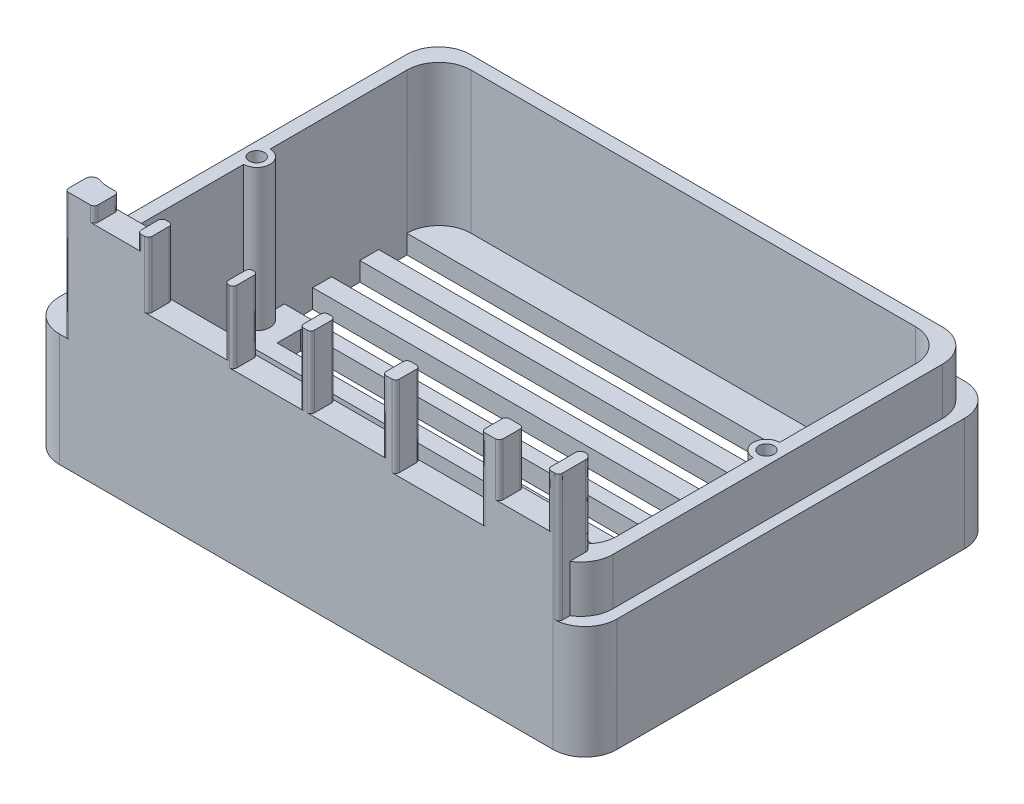
from build123d import *
from OCP.BRepAlgoAPI import BRepAlgoAPI_Cut
from OCP.TopTools import TopTools_ListOfShape

# Parameters (mm, degrees)
SKETCH1_W               = 118.4
SKETCH1_H               = 87.4
BOSS_EXTRUDE1_DEPTH     = 51
SKETCH2_W               = 108
SKETCH2_H               = 77
CUT_EXTRUDE1_DEPTH      = 47
SKETCH3_W               = 82.2
SKETCH3_H               = 17
CUT_EXTRUDE2_DEPTH      = 137.122187758
SKETCH4_W               = 118.4
SKETCH4_H               = 10
CUT_EXTRUDE4_DEPTH      = 2.4
CUT_EXTRUDE5_REACH      = 115.413
SKETCH5_W               = 5.6
SKETCH5_H               = 17
SKETCH5_W_2             = 8
SKETCH5_W_3             = 10.2
SKETCH5_H_2             = 11.2
SKETCH5_W_4             = 18.2
SKETCH5_H_3             = 17.2
SKETCH5_W_5             = 15.2
SKETCH5_H_4             = 15.2
SKETCH5_W_6             = 14.2
SKETCH5_W_7             = 16.2
SKETCH5_H_5             = 14
SKETCH5_W_8             = 9.2
SKETCH5_H_6             = 3.2
SKETCH6_W               = 85
SKETCH6_H               = 10
CUT_EXTRUDE6_DEPTH      = 2.3
SKETCH7_W               = 85
SKETCH7_H               = 10
CUT_EXTRUDE7_DEPTH      = 2.3
SKETCH8_W               = 5.7
SKETCH8_H               = 10
SKETCH8_W_2             = 3.3
CUT_EXTRUDE8_DEPTH      = 2.4
FILLET1_START           = -1
FILLET1_DEPTH           = 52
FILLET1_START_2         = 24
FILLET1_2_DEPTH         = 10
FILLET1_3_DEPTH         = 34
FILLET1_START_3         = 34
FILLET1_4_DEPTH         = 17
FILLET1_5_DEPTH         = 5.8
FILLET2_START           = 37
FILLET2_DEPTH           = 15
FILLET2_START_2         = 39.8
FILLET2_2_DEPTH         = 12.2
FILLET2_START_3         = 24
FILLET2_3_DEPTH         = 13.234576
FILLET2_START_4         = 35.8
FILLET2_4_DEPTH         = 1.434576
FILLET2_START_5         = 47.8
FILLET2_5_DEPTH         = 4.2
FILLET2_START_6         = 33.8
FILLET2_6_DEPTH         = 2.83586
BOSS_EXTRUDE2_DEPTH     = 30
CUT_EXTRUDE9_DEPTH      = 88.311683239
CUT_EXTRUDE9_DEPTH_BACK = 88.311683239
SKETCH10_R              = 1.6
SKETCH11_R              = 3.5
CUT_EXTRUDE10_DEPTH     = 2
SKETCH12_W              = 108
SKETCH12_H              = 6
SKETCH12_W_2            = 95.198067381
SKETCH12_H_2            = 5
CUT_EXTRUDE11_DEPTH     = 10
FILLET3_R               = 1.3


with BuildPart() as part:
    # Sketch1 → Boss-Extrude1 (new body)
    with BuildSketch(Plane(origin=(0, 0, 0), x_dir=(1, 0, 0), z_dir=(0, 1, 0))):
        Rectangle(SKETCH1_W, SKETCH1_H)
    extrude(amount=BOSS_EXTRUDE1_DEPTH)

    # Sketch2 → Cut-Extrude1 (cut)
    with BuildSketch(Plane(origin=(0, 51, 0), x_dir=(1, 0, 0), z_dir=(0, 1, 0))):
        Rectangle(SKETCH2_W, SKETCH2_H)
    extrude(amount=-CUT_EXTRUDE1_DEPTH, mode=Mode.SUBTRACT)

    # Sketch3 → Cut-Extrude2 (cut, through all)
    with BuildSketch(Plane.ZY.offset(59.2)):
        with Locations((-2.6, 42.5)):
            Rectangle(SKETCH3_W, SKETCH3_H)
    extrude(amount=-CUT_EXTRUDE2_DEPTH, mode=Mode.SUBTRACT)

    # Sketch4 → Cut-Extrude4 (cut)
    with BuildSketch(Plane(origin=(0, 0, -43.7), x_dir=(-1, 0, 0), z_dir=(0, 0, -1))):
        with Locations((0, 29)):
            Rectangle(SKETCH4_W, SKETCH4_H)
    extrude(amount=-CUT_EXTRUDE4_DEPTH, mode=Mode.SUBTRACT)

    # Sketch5 → Cut-Extrude5 (cut, up to next)
    with BuildSketch(Plane(origin=(0, 0, 38.5), x_dir=(-1, 0, 0), z_dir=(0, 0, -1)), mode=Mode.PRIVATE) as cut_extrude5_sk1:
        with Locations((-56.4, 42.5)):
            Rectangle(SKETCH5_W, SKETCH5_H)
    cut_extrude5_tool1 = extrude(cut_extrude5_sk1.sketch, amount=-CUT_EXTRUDE5_REACH, mode=Mode.PRIVATE) & part.part
    # Sketch5 → Cut-Extrude5 (cut, up to next)
    with BuildSketch(Plane(origin=(0, 0, 38.5), x_dir=(-1, 0, 0), z_dir=(0, 0, -1)), mode=Mode.PRIVATE) as cut_extrude5_sk2:
        with Locations((55.2, 42.5)):
            Rectangle(SKETCH5_W_2, SKETCH5_H)
    cut_extrude5_tool2 = extrude(cut_extrude5_sk2.sketch, amount=-CUT_EXTRUDE5_REACH, mode=Mode.PRIVATE) & part.part
    # Sketch5 → Cut-Extrude5 (cut, up to next)
    with BuildSketch(Plane(origin=(0, 0, 38.5), x_dir=(-1, 0, 0), z_dir=(0, 0, -1)), mode=Mode.PRIVATE) as cut_extrude5_sk3:
        with Locations((-46.1, 45.4)):
            Rectangle(SKETCH5_W_3, SKETCH5_H_2)
    cut_extrude5_tool3 = extrude(cut_extrude5_sk3.sketch, amount=-CUT_EXTRUDE5_REACH, mode=Mode.PRIVATE) & part.part
    # Sketch5 → Cut-Extrude5 (cut, up to next)
    with BuildSketch(Plane(origin=(0, 0, 38.5), x_dir=(-1, 0, 0), z_dir=(0, 0, -1)), mode=Mode.PRIVATE) as cut_extrude5_sk4:
        with Locations((-28.1, 42.4)):
            Rectangle(SKETCH5_W_4, SKETCH5_H_3)
    cut_extrude5_tool4 = extrude(cut_extrude5_sk4.sketch, amount=-CUT_EXTRUDE5_REACH, mode=Mode.PRIVATE) & part.part
    # Sketch5 → Cut-Extrude5 (cut, up to next)
    with BuildSketch(Plane(origin=(0, 0, 38.5), x_dir=(-1, 0, 0), z_dir=(0, 0, -1)), mode=Mode.PRIVATE) as cut_extrude5_sk5:
        with Locations((-8.6, 43.4)):
            Rectangle(SKETCH5_W_5, SKETCH5_H_4)
    cut_extrude5_tool5 = extrude(cut_extrude5_sk5.sketch, amount=-CUT_EXTRUDE5_REACH, mode=Mode.PRIVATE) & part.part
    # Sketch5 → Cut-Extrude5 (cut, up to next)
    with BuildSketch(Plane(origin=(0, 0, 38.5), x_dir=(-1, 0, 0), z_dir=(0, 0, -1)), mode=Mode.PRIVATE) as cut_extrude5_sk6:
        with Locations((8.4, 43.4)):
            Rectangle(SKETCH5_W_6, SKETCH5_H_4)
    cut_extrude5_tool6 = extrude(cut_extrude5_sk6.sketch, amount=-CUT_EXTRUDE5_REACH, mode=Mode.PRIVATE) & part.part
    # Sketch5 → Cut-Extrude5 (cut, up to next)
    with BuildSketch(Plane(origin=(0, 0, 38.5), x_dir=(-1, 0, 0), z_dir=(0, 0, -1)), mode=Mode.PRIVATE) as cut_extrude5_sk7:
        with Locations((25.4, 44)):
            Rectangle(SKETCH5_W_7, SKETCH5_H_5)
    cut_extrude5_tool7 = extrude(cut_extrude5_sk7.sketch, amount=-CUT_EXTRUDE5_REACH, mode=Mode.PRIVATE) & part.part
    # Sketch5 → Cut-Extrude5 (cut, up to next)
    with BuildSketch(Plane(origin=(0, 0, 38.5), x_dir=(-1, 0, 0), z_dir=(0, 0, -1)), mode=Mode.PRIVATE) as cut_extrude5_sk8:
        with Locations((40.4, 49.4)):
            Rectangle(SKETCH5_W_8, SKETCH5_H_6)
    cut_extrude5_tool8 = extrude(cut_extrude5_sk8.sketch, amount=-CUT_EXTRUDE5_REACH, mode=Mode.PRIVATE) & part.part
    add(cut_extrude5_tool1.solids().sort_by_distance((56.4, 42.5, 38.5))[0], mode=Mode.SUBTRACT)
    add(cut_extrude5_tool2.solids().sort_by_distance((-55.2, 42.5, 38.5))[0], mode=Mode.SUBTRACT)
    add(cut_extrude5_tool3.solids().sort_by_distance((46.1, 45.4, 38.5))[0], mode=Mode.SUBTRACT)
    add(cut_extrude5_tool4.solids().sort_by_distance((28.1, 42.4, 38.5))[0], mode=Mode.SUBTRACT)
    add(cut_extrude5_tool5.solids().sort_by_distance((8.6, 43.4, 38.5))[0], mode=Mode.SUBTRACT)
    add(cut_extrude5_tool6.solids().sort_by_distance((-8.4, 43.4, 38.5))[0], mode=Mode.SUBTRACT)
    add(cut_extrude5_tool7.solids().sort_by_distance((-25.4, 44, 38.5))[0], mode=Mode.SUBTRACT)
    add(cut_extrude5_tool8.solids().sort_by_distance((-40.4, 49.4, 38.5))[0], mode=Mode.SUBTRACT)

    # Sketch6 → Cut-Extrude6 (cut)
    with BuildSketch(Plane(origin=(59.2, 0, 0), x_dir=(0, 0, -1), z_dir=(1, 0, 0))):
        with Locations((-1.2, 29)):
            Rectangle(SKETCH6_W, SKETCH6_H)
    extrude(amount=-CUT_EXTRUDE6_DEPTH, mode=Mode.SUBTRACT)

    # Sketch7 → Cut-Extrude7 (cut)
    with BuildSketch(Plane.ZY.offset(59.2)):
        with Locations((1.2, 29)):
            Rectangle(SKETCH7_W, SKETCH7_H)
    extrude(amount=-CUT_EXTRUDE7_DEPTH, mode=Mode.SUBTRACT)

    # Sketch8 → Cut-Extrude8 (cut)
    with BuildSketch(Plane.XY.offset(43.7)):
        with Locations((-54.05, 29)):
            Rectangle(SKETCH8_W, SKETCH8_H)
        with Locations((55.25, 29)):
            Rectangle(SKETCH8_W_2, SKETCH8_H)
    extrude(amount=-CUT_EXTRUDE8_DEPTH, mode=Mode.SUBTRACT)

    # Fillet1: read off the stored shape, not the designer's step
    # Fillet1 outline → Fillet1 (cut)
    with BuildSketch(Plane(origin=(0, 0, 0), x_dir=(1, 0, 0), z_dir=(0, 1, 0)).offset(FILLET1_START)):
        with BuildLine():
            Line((52.4, -43.7), (59.2, -43.7))
            Line((59.2, -43.7), (59.2, -36.9))
            add(Edge.make_bspline(
                [(59.2, -36.9), (59.2, -38.590026549), (58.664314748, -40.570505841), (57.311811615, -42.306908661), (55.374285461, -43.275178701), (53.355064375, -43.637193322), (53.111635527, -43.669272126), (52.870751402, -43.689994374), (52.633303895, -43.7), (52.4, -43.7)],
                knots=[0, 0, 0, 0, 0, 0, 0.878697966, 0.878697966, 0.878697966, 0.878697966, 1, 1, 1, 1, 1, 1], degree=5, weights=[1, 1, 0.980118224, 0.977315352, 1, 1, 1.000001049, 1.000001832, 1, 1]))
        make_face()
        with BuildLine():
            Line((-59.2, -43.7), (-52.4, -43.7))
            add(Edge.make_bspline(
                [(-52.4, -43.7), (-59.2, -43.7), (-59.2, -36.9)],
                knots=[0, 0, 0, 1, 1, 1], degree=2, weights=[1, 0.707106781, 1]))
            Line((-59.2, -36.9), (-59.2, -43.7))
        make_face()
        with BuildLine():
            Line((-59.2, 43.7), (-59.2, 36.9))
            add(Edge.make_bspline(
                [(-59.2, 36.9), (-59.2, 43.7), (-52.4, 43.7)],
                knots=[0, 0, 0, 1, 1, 1], degree=2, weights=[1, 0.707106781, 1]))
            Line((-52.4, 43.7), (-59.2, 43.7))
        make_face()
        with BuildLine():
            add(Edge.make_bspline(
                [(52.4, 43.7), (59.2, 43.7), (59.2, 36.9)],
                knots=[0, 0, 0, 1, 1, 1], degree=2, weights=[1, 0.707106781, 1]))
            Line((59.2, 36.9), (59.2, 43.7))
            Line((59.2, 43.7), (52.4, 43.7))
        make_face()
    extrude(amount=FILLET1_DEPTH, mode=Mode.SUBTRACT)

    # Fillet1 2 outline → Fillet1 2 (cut)
    with BuildSketch(Plane(origin=(0, 0, 0), x_dir=(1, 0, 0), z_dir=(0, 1, 0)).offset(FILLET1_START_2)):
        with BuildLine():
            Line((-56.9, -41.3), (-51.2, -41.3))
            add(Edge.make_bspline(
                [(-51.2, -41.3), (-56.9, -40.365634989), (-56.9, -34.589560372)],
                knots=[0, 0, 0, 1, 1, 1], degree=2, weights=[1, 0.762156384, 1]))
            Line((-56.9, -34.589560372), (-56.9, -41.3))
        make_face()
        with BuildLine():
            add(Edge.make_bspline(
                [(53.6, -41.3), (56.9, -39.318899982), (56.9, -35.469905661)],
                knots=[0, 0, 0, 1, 1, 1], degree=2, weights=[1, 0.870260272, 1]))
            Line((53.6, -41.3), (56.9, -41.3))
            Line((56.9, -41.3), (56.9, -35.469905661))
        make_face()
        with BuildLine():
            Line((-56.9, 41.3), (-56.9, 34.5))
            add(Edge.make_bspline(
                [(-56.9, 34.5), (-56.9, 41.3), (-50.1, 41.3)],
                knots=[0, 0, 0, 1, 1, 1], degree=2, weights=[1, 0.707106781, 1]))
            Line((-50.1, 41.3), (-56.9, 41.3))
        make_face()
        with BuildLine():
            add(Edge.make_bspline(
                [(56.9, 34.5), (56.9, 41.3), (50.1, 41.3)],
                knots=[0, 0, 0, 1, 1, 1], degree=2, weights=[1, 0.707106781, 1]))
            Line((56.9, 34.5), (56.9, 41.3))
            Line((56.9, 41.3), (50.1, 41.3))
        make_face()
    extrude(amount=FILLET1_2_DEPTH, mode=Mode.SUBTRACT)

    # Fillet1 3 outline → Fillet1 3 (add)
    with BuildSketch(Plane(origin=(0, 0, 0), x_dir=(1, 0, 0), z_dir=(0, 1, 0))):
        with BuildLine():
            add(Edge.make_bspline(
                [(-47.2, -38.5), (-47.979596074, -38.5), (-48.805907772, -38.388247039), (-49.651414457, -38.1381004), (-50.465894952, -37.733073683), (-52.27699513, -36.415692151), (-53.191387112, -35.345675661), (-53.758854429, -34.09383083), (-54, -32.843734371), (-54, -31.7)],
                knots=[0, 0, 0, 0, 0, 0, 0.405336523, 0.405336523, 0.405336523, 0.405336523, 1, 1, 1, 1, 1, 1], degree=5, weights=[1, 1, 0.999726836, 0.999433949, 1, 1, 0.995728847, 0.997176775, 1, 1]))
            Line((-54, -31.7), (-54, -38.5))
            Line((-54, -38.5), (-47.2, -38.5))
        make_face()
        with BuildLine():
            Line((47.2, -38.5), (54, -38.5))
            Line((54, -38.5), (54, -31.7))
            add(Edge.make_bspline(
                [(54, -31.7), (54, -32.141646182), (53.964145171, -32.598139039), (53.887610478, -33.064701212), (53.766491651, -33.534105438), (53.335326997, -34.735003554), (52.955521738, -35.458885404), (52.458741016, -36.131453078), (51.861119906, -36.718196864), (50.465894952, -37.733073683), (49.651414457, -38.1381004), (48.805907772, -38.388247039), (47.979596074, -38.5), (47.2, -38.5)],
                knots=[0, 0, 0, 0, 0, 0, 0.229625743, 0.229625743, 0.229625743, 0.229625743, 0.594663477, 0.594663477, 0.594663477, 0.594663477, 1, 1, 1, 1, 1, 1], degree=5, weights=[1, 1, 1.000005527, 0.999986472, 1, 1, 0.999289956, 0.99922285, 1, 1, 0.999433949, 0.999726836, 1, 1]))
        make_face()
        with BuildLine():
            Line((-54, 38.5), (-54, 31.7))
            add(Edge.make_bspline(
                [(-54, 31.7), (-54, 38.5), (-47.2, 38.5)],
                knots=[0, 0, 0, 1, 1, 1], degree=2, weights=[1, 0.707106781, 1]))
            Line((-47.2, 38.5), (-54, 38.5))
        make_face()
        with BuildLine():
            Line((54, 38.5), (47.2, 38.5))
            add(Edge.make_bspline(
                [(47.2, 38.5), (54, 38.5), (54, 31.7)],
                knots=[0, 0, 0, 1, 1, 1], degree=2, weights=[1, 0.707106781, 1]))
            Line((54, 31.7), (54, 38.5))
        make_face()
    extrude(amount=FILLET1_3_DEPTH)

    # Fillet1 4 outline → Fillet1 4 (add)
    with BuildSketch(Plane(origin=(0, 0, 0), x_dir=(1, 0, 0), z_dir=(0, 1, 0)).offset(FILLET1_START_3)):
        with BuildLine():
            Line((-51.2, -38.5), (-47.2, -38.5))
            add(Edge.make_bspline(
                [(-47.2, -38.5), (-49.411545582, -38.5), (-51.2, -37.199090834)],
                knots=[0, 0, 0, 0.405336523, 0.405336523, 0.405336523], degree=2, weights=[1, 0.881279681, 0.858802725]))
            Line((-51.2, -37.199090834), (-51.2, -38.5))
        make_face()
        with BuildLine():
            add(Edge.make_bspline(
                [(53.6, -33.997825059), (52.892697239, -35.967834767), (51.2, -37.199090834)],
                knots=[0.229625743, 0.229625743, 0.229625743, 0.594663477, 0.594663477, 0.594663477], degree=2, weights=[0.896375691, 0.83856044, 0.858802725]))
            Line((51.2, -37.199090834), (51.2, -38.5))
            Line((51.2, -38.5), (53.6, -38.5))
            Line((53.6, -38.5), (53.6, -33.997825059))
        make_face()
    extrude(amount=FILLET1_4_DEPTH)

    # Fillet1 5 outline → Fillet1 5 (add)
    with BuildSketch(Plane(origin=(0, 0, 0), x_dir=(1, 0, 0), z_dir=(0, 1, 0)).offset(FILLET1_START_3)):
        with BuildLine():
            add(Edge.make_bspline(
                [(51.2, -37.199090834), (49.411545582, -38.5), (47.2, -38.5)],
                knots=[0.594663477, 0.594663477, 0.594663477, 1, 1, 1], degree=2, weights=[0.858802725, 0.881279681, 1]))
            Line((47.2, -38.5), (51.2, -38.5))
            Line((51.2, -38.5), (51.2, -37.199090834))
        make_face()
    extrude(amount=FILLET1_5_DEPTH)


with BuildPart() as fillet2_tool:
    # Fillet2: read off the stored shape, not the designer's step
    # Fillet2 outline → Fillet2 (new body)
    with BuildSketch(Plane(origin=(0, 0, 0), x_dir=(1.0, -2.468840305253112e-12, 0), z_dir=(2.468840305253112e-12, 1.0, 1.6764333355453864e-12)).offset(FILLET2_START)):
        with BuildLine():
            Line((53.6, -43.593280212), (53.6, -42.886651819))
            add(Edge.make_bspline(
                [(53.6, -42.886651819), (53.6, -43.634983296), (52.853333333, -43.684872061)],
                knots=[0, 0, 0, 1, 1, 1], degree=2, weights=[1, 0.730296743, 1]))
            add(Edge.make_bspline(
                [(53.6, -43.593280212), (53.229203683, -43.659758167), (52.853333333, -43.684872061)],
                knots=[0.878697966, 0.878697966, 0.878697966, 0.953450483, 0.953450483, 0.953450483], degree=2, weights=[0.937562283, 0.954145092, 0.97400124]))
        make_face()
        with BuildLine():
            Line((37.2, -43.7), (38, -43.7))
            add(Edge.make_bspline(
                [(37.2, -42.9), (37.2, -43.7), (38, -43.7)],
                knots=[0, 0, 0, 1, 1, 1], degree=2, weights=[1, 0.707106781, 1]))
            Line((37.2, -42.9), (37.2, -43.7))
        make_face()
        with BuildLine():
            add(Edge.make_bspline(
                [(37.2, -39.3), (37.2, -38.5), (38, -38.5)],
                knots=[0, 0, 0, 1, 1, 1], degree=2, weights=[1, 0.707106781, 1]))
            Line((38, -38.5), (37.2, -38.5))
            Line((37.2, -38.5), (37.2, -39.3))
        make_face()
        with BuildLine():
            Line((18.2, -43.7), (19, -43.7))
            Line((19, -43.7), (19, -42.9))
            add(Edge.make_bspline(
                [(19, -42.9), (19, -43.7), (18.2, -43.7)],
                knots=[0, 0, 0, 1, 1, 1], degree=2, weights=[1, 0.707106781, 1]))
        make_face()
        with BuildLine():
            Line((19, -39.3), (19, -38.5))
            Line((19, -38.5), (18.2, -38.5))
            add(Edge.make_bspline(
                [(19, -39.3), (19, -38.5), (18.2, -38.5)],
                knots=[0, 0, 0, 1, 1, 1], degree=2, weights=[1, 0.707106781, 1]))
        make_face()
        with BuildLine():
            Line((16.2, -43.7), (17, -43.7))
            add(Edge.make_bspline(
                [(16.2, -42.9), (16.2, -43.7), (17, -43.7)],
                knots=[0, 0, 0, 1, 1, 1], degree=2, weights=[1, 0.707106781, 1]))
            Line((16.2, -42.9), (16.2, -43.7))
        make_face()
        with BuildLine():
            add(Edge.make_bspline(
                [(16.2, -39.3), (16.2, -38.5), (17, -38.5)],
                knots=[0, 0, 0, 1, 1, 1], degree=2, weights=[1, 0.707106781, 1]))
            Line((17, -38.5), (16.2, -38.5))
            Line((16.2, -38.5), (16.2, -39.3))
        make_face()
        with BuildLine():
            Line((0.2, -43.7), (1, -43.7))
            Line((1, -43.7), (1, -42.9))
            add(Edge.make_bspline(
                [(1, -42.9), (1, -43.7), (0.2, -43.7)],
                knots=[0, 0, 0, 1, 1, 1], degree=2, weights=[1, 0.707106781, 1]))
        make_face()
        with BuildLine():
            Line((1, -39.3), (1, -38.5))
            Line((1, -38.5), (0.2, -38.5))
            add(Edge.make_bspline(
                [(1, -39.3), (1, -38.5), (0.2, -38.5)],
                knots=[0, 0, 0, 1, 1, 1], degree=2, weights=[1, 0.707106781, 1]))
        make_face()
        with BuildLine():
            Line((-1.3, -43.7), (-0.5, -43.7))
            add(Edge.make_bspline(
                [(-1.3, -42.9), (-1.3, -43.7), (-0.5, -43.7)],
                knots=[0, 0, 0, 1, 1, 1], degree=2, weights=[1, 0.707106781, 1]))
            Line((-1.3, -42.9), (-1.3, -43.7))
        make_face()
        with BuildLine():
            add(Edge.make_bspline(
                [(-1.3, -39.3), (-1.3, -38.5), (-0.5, -38.5)],
                knots=[0, 0, 0, 1, 1, 1], degree=2, weights=[1, 0.707106781, 1]))
            Line((-0.5, -38.5), (-1.3, -38.5))
            Line((-1.3, -38.5), (-1.3, -39.3))
        make_face()
        with BuildLine():
            Line((-16.3, -43.7), (-15.5, -43.7))
            Line((-15.5, -43.7), (-15.5, -42.9))
            add(Edge.make_bspline(
                [(-15.5, -42.9), (-15.5, -43.7), (-16.3, -43.7)],
                knots=[0, 0, 0, 1, 1, 1], degree=2, weights=[1, 0.707106781, 1]))
        make_face()
        with BuildLine():
            Line((-15.5, -39.3), (-15.5, -38.5))
            Line((-15.5, -38.5), (-16.3, -38.5))
            add(Edge.make_bspline(
                [(-15.5, -39.3), (-15.5, -38.5), (-16.3, -38.5)],
                knots=[0, 0, 0, 1, 1, 1], degree=2, weights=[1, 0.707106781, 1]))
        make_face()
        with BuildLine():
            Line((-17.3, -43.7), (-16.5, -43.7))
            add(Edge.make_bspline(
                [(-17.3, -42.9), (-17.3, -43.7), (-16.5, -43.7)],
                knots=[0, 0, 0, 1, 1, 1], degree=2, weights=[1, 0.707106781, 1]))
            Line((-17.3, -42.9), (-17.3, -43.7))
        make_face()
        with BuildLine():
            add(Edge.make_bspline(
                [(-17.3, -39.3), (-17.3, -38.5), (-16.5, -38.5)],
                knots=[0, 0, 0, 1, 1, 1], degree=2, weights=[1, 0.707106781, 1]))
            Line((-16.5, -38.5), (-17.3, -38.5))
            Line((-17.3, -38.5), (-17.3, -39.3))
        make_face()
        with BuildLine():
            Line((-34.3, -43.7), (-33.5, -43.7))
            Line((-33.5, -43.7), (-33.5, -42.9))
            add(Edge.make_bspline(
                [(-33.5, -42.9), (-33.5, -43.7), (-34.3, -43.7)],
                knots=[0, 0, 0, 1, 1, 1], degree=2, weights=[1, 0.707106781, 1]))
        make_face()
        with BuildLine():
            Line((-33.5, -39.3), (-33.5, -38.5))
            Line((-33.5, -38.5), (-34.3, -38.5))
            add(Edge.make_bspline(
                [(-33.5, -39.3), (-33.5, -38.5), (-34.3, -38.5)],
                knots=[0, 0, 0, 1, 1, 1], degree=2, weights=[1, 0.707106781, 1]))
        make_face()
        with BuildLine():
            Line((-51.2, -43.7), (-50.4, -43.7))
            add(Edge.make_bspline(
                [(-51.2, -42.9), (-51.2, -43.7), (-50.4, -43.7)],
                knots=[0, 0, 0, 1, 1, 1], degree=2, weights=[1, 0.707106781, 1]))
            Line((-51.2, -42.9), (-51.2, -43.7))
        make_face()
    extrude(amount=FILLET2_DEPTH)


with BuildPart() as part_1:
    add(part.part)

    # Fillet2: cut by fillet2_tool, with a tolerance
    fillet2_stock = TopTools_ListOfShape()
    fillet2_stock.Append(part_1.part.wrapped)
    fillet2_tools = TopTools_ListOfShape()
    fillet2_tools.Append(fillet2_tool.part.wrapped)
    fillet2_cut = BRepAlgoAPI_Cut()
    fillet2_cut.SetArguments(fillet2_stock)
    fillet2_cut.SetTools(fillet2_tools)
    fillet2_cut.SetFuzzyValue(0.00001)
    fillet2_cut.Build()
    add(Compound.cast(fillet2_cut.Shape()).solids(), mode=Mode.REPLACE)


with BuildPart() as fillet2_2_tool:
    # Fillet2 2 outline → Fillet2 2 (new body)
    with BuildSketch(Plane(origin=(0, 0, 0), x_dir=(1.0, -2.468840305253112e-12, 0), z_dir=(2.468840305253112e-12, 1.0, 1.6764333355453864e-12)).offset(FILLET2_START_2)):
        with BuildLine():
            Line((51.2, -43.7), (52, -43.7))
            add(Edge.make_bspline(
                [(51.2, -42.9), (51.2, -43.7), (52, -43.7)],
                knots=[0, 0, 0, 1, 1, 1], degree=2, weights=[1, 0.707106781, 1]))
            Line((51.2, -42.9), (51.2, -43.7))
        make_face()
        with BuildLine():
            add(Edge.make_bspline(
                [(51.494736842, -36.972118688), (51.2, -37.212215174), (51.2, -37.592367945)],
                knots=[0, 0, 0, 1, 1, 1], degree=2, weights=[1, 0.903210647, 1]))
            add(Edge.make_bspline(
                [(51.494736842, -36.972118688), (51.350473785, -37.089637261), (51.2, -37.199090834)],
                knots=[0.561500966, 0.561500966, 0.561500966, 0.594663477, 0.594663477, 0.594663477], degree=2, weights=[0.855769051, 0.856963778, 0.858802725]))
            Line((51.2, -37.199090834), (51.2, -37.592367945))
        make_face()
        with BuildLine():
            Line((40.2, -43.7), (41, -43.7))
            Line((41, -43.7), (41, -42.9))
            add(Edge.make_bspline(
                [(41, -42.9), (41, -43.7), (40.2, -43.7)],
                knots=[0, 0, 0, 1, 1, 1], degree=2, weights=[1, 0.707106781, 1]))
        make_face()
        with BuildLine():
            Line((41, -39.3), (41, -38.5))
            Line((41, -38.5), (40.2, -38.5))
            add(Edge.make_bspline(
                [(41, -39.3), (41, -38.5), (40.2, -38.5)],
                knots=[0, 0, 0, 1, 1, 1], degree=2, weights=[1, 0.707106781, 1]))
        make_face()
    extrude(amount=FILLET2_2_DEPTH)


with BuildPart() as part_2:
    add(part_1.part)

    # Fillet2 2: cut by fillet2_2_tool, with a tolerance
    fillet2_2_stock = TopTools_ListOfShape()
    fillet2_2_stock.Append(part_2.part.wrapped)
    fillet2_2_tools = TopTools_ListOfShape()
    fillet2_2_tools.Append(fillet2_2_tool.part.wrapped)
    fillet2_2_cut = BRepAlgoAPI_Cut()
    fillet2_2_cut.SetArguments(fillet2_2_stock)
    fillet2_2_cut.SetTools(fillet2_2_tools)
    fillet2_2_cut.SetFuzzyValue(0.00001)
    fillet2_2_cut.Build()
    add(Compound.cast(fillet2_2_cut.Shape()).solids(), mode=Mode.REPLACE)


with BuildPart() as fillet2_3_tool:
    # Fillet2 3 outline → Fillet2 3 (new body)
    with BuildSketch(Plane(origin=(0, 0, 0), x_dir=(1.0, -2.468840305253112e-12, 0), z_dir=(2.468840305253112e-12, 1.0, 1.6764333355453864e-12)).offset(FILLET2_START_3)):
        with BuildLine():
            Line((53.6, -43.593280212), (53.6, -42.886651819))
            add(Edge.make_bspline(
                [(53.6, -42.886651819), (53.6, -43.634983296), (52.853333333, -43.684872061)],
                knots=[0, 0, 0, 1, 1, 1], degree=2, weights=[1, 0.730296743, 1]))
            add(Edge.make_bspline(
                [(53.6, -43.593280212), (53.229203683, -43.659758167), (52.853333333, -43.684872061)],
                knots=[0.878697966, 0.878697966, 0.878697966, 0.953450483, 0.953450483, 0.953450483], degree=2, weights=[0.937562283, 0.954145092, 0.97400124]))
        make_face()
        with BuildLine():
            Line((-51.2, -43.7), (-50.4, -43.7))
            add(Edge.make_bspline(
                [(-51.2, -42.9), (-51.2, -43.7), (-50.4, -43.7)],
                knots=[0, 0, 0, 1, 1, 1], degree=2, weights=[1, 0.707106781, 1]))
            Line((-51.2, -42.9), (-51.2, -43.7))
        make_face()
    extrude(amount=FILLET2_3_DEPTH)


with BuildPart() as part_3:
    add(part_2.part)

    # Fillet2 3: cut by fillet2_3_tool, with a tolerance
    fillet2_3_stock = TopTools_ListOfShape()
    fillet2_3_stock.Append(part_3.part.wrapped)
    fillet2_3_tools = TopTools_ListOfShape()
    fillet2_3_tools.Append(fillet2_3_tool.part.wrapped)
    fillet2_3_cut = BRepAlgoAPI_Cut()
    fillet2_3_cut.SetArguments(fillet2_3_stock)
    fillet2_3_cut.SetTools(fillet2_3_tools)
    fillet2_3_cut.SetFuzzyValue(0.00001)
    fillet2_3_cut.Build()
    add(Compound.cast(fillet2_3_cut.Shape()).solids(), mode=Mode.REPLACE)


with BuildPart() as fillet2_4_tool:
    # Fillet2 4 outline → Fillet2 4 (new body)
    with BuildSketch(Plane(origin=(0, 0, 0), x_dir=(1.0, -2.468840305253112e-12, 0), z_dir=(2.468840305253112e-12, 1.0, 1.6764333355453864e-12)).offset(FILLET2_START_4)):
        with BuildLine():
            Line((37.2, -43.7), (38, -43.7))
            add(Edge.make_bspline(
                [(37.2, -42.9), (37.2, -43.7), (38, -43.7)],
                knots=[0, 0, 0, 1, 1, 1], degree=2, weights=[1, 0.707106781, 1]))
            Line((37.2, -42.9), (37.2, -43.7))
        make_face()
        with BuildLine():
            add(Edge.make_bspline(
                [(37.2, -39.3), (37.2, -38.5), (38, -38.5)],
                knots=[0, 0, 0, 1, 1, 1], degree=2, weights=[1, 0.707106781, 1]))
            Line((38, -38.5), (37.2, -38.5))
            Line((37.2, -38.5), (37.2, -39.3))
        make_face()
        with BuildLine():
            Line((18.2, -43.7), (19, -43.7))
            Line((19, -43.7), (19, -42.9))
            add(Edge.make_bspline(
                [(19, -42.9), (19, -43.7), (18.2, -43.7)],
                knots=[0, 0, 0, 1, 1, 1], degree=2, weights=[1, 0.707106781, 1]))
        make_face()
        with BuildLine():
            Line((19, -39.3), (19, -38.5))
            Line((19, -38.5), (18.2, -38.5))
            add(Edge.make_bspline(
                [(19, -39.3), (19, -38.5), (18.2, -38.5)],
                knots=[0, 0, 0, 1, 1, 1], degree=2, weights=[1, 0.707106781, 1]))
        make_face()
        with BuildLine():
            Line((16.2, -43.7), (17, -43.7))
            add(Edge.make_bspline(
                [(16.2, -42.9), (16.2, -43.7), (17, -43.7)],
                knots=[0, 0, 0, 1, 1, 1], degree=2, weights=[1, 0.707106781, 1]))
            Line((16.2, -42.9), (16.2, -43.7))
        make_face()
        with BuildLine():
            add(Edge.make_bspline(
                [(16.2, -39.3), (16.2, -38.5), (17, -38.5)],
                knots=[0, 0, 0, 1, 1, 1], degree=2, weights=[1, 0.707106781, 1]))
            Line((17, -38.5), (16.2, -38.5))
            Line((16.2, -38.5), (16.2, -39.3))
        make_face()
        with BuildLine():
            Line((0.2, -43.7), (1, -43.7))
            Line((1, -43.7), (1, -42.9))
            add(Edge.make_bspline(
                [(1, -42.9), (1, -43.7), (0.2, -43.7)],
                knots=[0, 0, 0, 1, 1, 1], degree=2, weights=[1, 0.707106781, 1]))
        make_face()
        with BuildLine():
            Line((1, -39.3), (1, -38.5))
            Line((1, -38.5), (0.2, -38.5))
            add(Edge.make_bspline(
                [(1, -39.3), (1, -38.5), (0.2, -38.5)],
                knots=[0, 0, 0, 1, 1, 1], degree=2, weights=[1, 0.707106781, 1]))
        make_face()
        with BuildLine():
            Line((-1.3, -43.7), (-0.5, -43.7))
            add(Edge.make_bspline(
                [(-1.3, -42.9), (-1.3, -43.7), (-0.5, -43.7)],
                knots=[0, 0, 0, 1, 1, 1], degree=2, weights=[1, 0.707106781, 1]))
            Line((-1.3, -42.9), (-1.3, -43.7))
        make_face()
        with BuildLine():
            add(Edge.make_bspline(
                [(-1.3, -39.3), (-1.3, -38.5), (-0.5, -38.5)],
                knots=[0, 0, 0, 1, 1, 1], degree=2, weights=[1, 0.707106781, 1]))
            Line((-0.5, -38.5), (-1.3, -38.5))
            Line((-1.3, -38.5), (-1.3, -39.3))
        make_face()
        with BuildLine():
            Line((-16.3, -43.7), (-15.5, -43.7))
            Line((-15.5, -43.7), (-15.5, -42.9))
            add(Edge.make_bspline(
                [(-15.5, -42.9), (-15.5, -43.7), (-16.3, -43.7)],
                knots=[0, 0, 0, 1, 1, 1], degree=2, weights=[1, 0.707106781, 1]))
        make_face()
        with BuildLine():
            Line((-15.5, -39.3), (-15.5, -38.5))
            Line((-15.5, -38.5), (-16.3, -38.5))
            add(Edge.make_bspline(
                [(-15.5, -39.3), (-15.5, -38.5), (-16.3, -38.5)],
                knots=[0, 0, 0, 1, 1, 1], degree=2, weights=[1, 0.707106781, 1]))
        make_face()
    extrude(amount=FILLET2_4_DEPTH)


with BuildPart() as part_4:
    add(part_3.part)

    # Fillet2 4: cut by fillet2_4_tool, with a tolerance
    fillet2_4_stock = TopTools_ListOfShape()
    fillet2_4_stock.Append(part_4.part.wrapped)
    fillet2_4_tools = TopTools_ListOfShape()
    fillet2_4_tools.Append(fillet2_4_tool.part.wrapped)
    fillet2_4_cut = BRepAlgoAPI_Cut()
    fillet2_4_cut.SetArguments(fillet2_4_stock)
    fillet2_4_cut.SetTools(fillet2_4_tools)
    fillet2_4_cut.SetFuzzyValue(0.00001)
    fillet2_4_cut.Build()
    add(Compound.cast(fillet2_4_cut.Shape()).solids(), mode=Mode.REPLACE)


with BuildPart() as fillet2_5_tool:
    # Fillet2 5 outline → Fillet2 5 (new body)
    with BuildSketch(Plane(origin=(0, 0, 0), x_dir=(1.0, -2.468840305253112e-12, 0), z_dir=(2.468840305253112e-12, 1.0, 1.6764333355453864e-12)).offset(FILLET2_START_5)):
        with BuildLine():
            Line((-35.8, -43.7), (-35, -43.7))
            add(Edge.make_bspline(
                [(-35.8, -42.9), (-35.8, -43.7), (-35, -43.7)],
                knots=[0, 0, 0, 1, 1, 1], degree=2, weights=[1, 0.707106781, 1]))
            Line((-35.8, -42.9), (-35.8, -43.7))
        make_face()
        with BuildLine():
            add(Edge.make_bspline(
                [(-35.8, -39.3), (-35.8, -38.5), (-35, -38.5)],
                knots=[0, 0, 0, 1, 1, 1], degree=2, weights=[1, 0.707106781, 1]))
            Line((-35, -38.5), (-35.8, -38.5))
            Line((-35.8, -38.5), (-35.8, -39.3))
        make_face()
        with BuildLine():
            Line((-45.8, -43.7), (-45, -43.7))
            Line((-45, -43.7), (-45, -42.9))
            add(Edge.make_bspline(
                [(-45, -42.9), (-45, -43.7), (-45.8, -43.7)],
                knots=[0, 0, 0, 1, 1, 1], degree=2, weights=[1, 0.707106781, 1]))
        make_face()
        with BuildLine():
            Line((-45, -39.3), (-45, -38.5))
            Line((-45, -38.5), (-45.8, -38.5))
            add(Edge.make_bspline(
                [(-45, -39.3), (-45, -38.5), (-45.8, -38.5)],
                knots=[0, 0, 0, 1, 1, 1], degree=2, weights=[1, 0.707106781, 1]))
        make_face()
    extrude(amount=FILLET2_5_DEPTH)


with BuildPart() as part_5:
    add(part_4.part)

    # Fillet2 5: cut by fillet2_5_tool, with a tolerance
    fillet2_5_stock = TopTools_ListOfShape()
    fillet2_5_stock.Append(part_5.part.wrapped)
    fillet2_5_tools = TopTools_ListOfShape()
    fillet2_5_tools.Append(fillet2_5_tool.part.wrapped)
    fillet2_5_cut = BRepAlgoAPI_Cut()
    fillet2_5_cut.SetArguments(fillet2_5_stock)
    fillet2_5_cut.SetTools(fillet2_5_tools)
    fillet2_5_cut.SetFuzzyValue(0.00001)
    fillet2_5_cut.Build()
    add(Compound.cast(fillet2_5_cut.Shape()).solids(), mode=Mode.REPLACE)


with BuildPart() as fillet2_6_tool:
    # Fillet2 6 outline → Fillet2 6 (new body)
    with BuildSketch(Plane(origin=(0, 0, 0), x_dir=(1.0, -2.468840305253112e-12, 0), z_dir=(2.468840305253112e-12, 1.0, 1.6764333355453864e-12)).offset(FILLET2_START_6)):
        with BuildLine():
            Line((37.2, -43.7), (38, -43.7))
            add(Edge.make_bspline(
                [(37.2, -42.9), (37.2, -43.7), (38, -43.7)],
                knots=[0, 0, 0, 1, 1, 1], degree=2, weights=[1, 0.707106781, 1]))
            Line((37.2, -42.9), (37.2, -43.7))
        make_face()
        with BuildLine():
            add(Edge.make_bspline(
                [(37.2, -39.3), (37.2, -38.5), (38, -38.5)],
                knots=[0, 0, 0, 1, 1, 1], degree=2, weights=[1, 0.707106781, 1]))
            Line((38, -38.5), (37.2, -38.5))
            Line((37.2, -38.5), (37.2, -39.3))
        make_face()
        with BuildLine():
            Line((18.2, -43.7), (19, -43.7))
            Line((19, -43.7), (19, -42.9))
            add(Edge.make_bspline(
                [(19, -42.9), (19, -43.7), (18.2, -43.7)],
                knots=[0, 0, 0, 1, 1, 1], degree=2, weights=[1, 0.707106781, 1]))
        make_face()
        with BuildLine():
            Line((19, -39.3), (19, -38.5))
            Line((19, -38.5), (18.2, -38.5))
            add(Edge.make_bspline(
                [(19, -39.3), (19, -38.5), (18.2, -38.5)],
                knots=[0, 0, 0, 1, 1, 1], degree=2, weights=[1, 0.707106781, 1]))
        make_face()
    extrude(amount=FILLET2_6_DEPTH)


with BuildPart() as part_6:
    add(part_5.part)

    # Fillet2 6: cut by fillet2_6_tool, with a tolerance
    fillet2_6_stock = TopTools_ListOfShape()
    fillet2_6_stock.Append(part_6.part.wrapped)
    fillet2_6_tools = TopTools_ListOfShape()
    fillet2_6_tools.Append(fillet2_6_tool.part.wrapped)
    fillet2_6_cut = BRepAlgoAPI_Cut()
    fillet2_6_cut.SetArguments(fillet2_6_stock)
    fillet2_6_cut.SetTools(fillet2_6_tools)
    fillet2_6_cut.SetFuzzyValue(0.00001)
    fillet2_6_cut.Build()
    add(Compound.cast(fillet2_6_cut.Shape()).solids(), mode=Mode.REPLACE)

    # Sketch9 → Boss-Extrude2 (add)
    with BuildSketch(Plane(origin=(0, 4, 0), x_dir=(1, 0, 0), z_dir=(0, 1, 0))):
        with BuildLine():
            ThreePointArc((-54, -2.955383491), (-51.2, -0.155383491), (-54, 2.644616509))
            Line((-54, 2.644616509), (-54, -2.955383491))
        make_face()
        with BuildLine():
            Line((54, -2.8), (54, 2.8))
            ThreePointArc((54, 2.8), (51.2, 0), (54, -2.8))
        make_face()
    extrude(amount=BOSS_EXTRUDE2_DEPTH)

    # Sketch10 → Cut-Extrude9 (cut, two sides: drawn at the far end of the back side and taken through both)
    with BuildSketch(Plane(origin=(0, 4, 0), x_dir=(1, 0, 0), z_dir=(0, 1, 0)).offset(-CUT_EXTRUDE9_DEPTH_BACK)):
        with Locations(Location((-54, -0.18918783, 0), (0, 0, 90))):
            Circle(SKETCH10_R)
        with Locations(Location((54, 0, 0), (0, 0, 90))):
            Circle(SKETCH10_R)
    extrude(amount=CUT_EXTRUDE9_DEPTH + CUT_EXTRUDE9_DEPTH_BACK, mode=Mode.SUBTRACT)

    # Sketch11 → Cut-Extrude10 (cut)
    with BuildSketch(Plane.XZ):
        with Locations(Location((-54, 0.18918783, 0), (0, 0, 270))):
            Circle(SKETCH11_R)
        with Locations(Location((54, 0, 0), (0, 0, 270))):
            Circle(SKETCH11_R)
    extrude(amount=-CUT_EXTRUDE10_DEPTH, mode=Mode.SUBTRACT)

    # Sketch12 → Cut-Extrude11 (cut)
    with BuildSketch(Plane(origin=(0, 4, 0), x_dir=(1, 0, 0), z_dir=(0, 1, 0))):
        with Locations((0, 28.7)):
            Rectangle(SKETCH12_W, SKETCH12_H)
        with Locations((0, 18.7)):
            Rectangle(SKETCH12_W, SKETCH12_H)
        with Locations((0, 8.7)):
            Rectangle(SKETCH12_W, SKETCH12_H)
        with Locations((0, -8.7)):
            Rectangle(SKETCH12_W, SKETCH12_H)
        with Locations((0, -18.7)):
            Rectangle(SKETCH12_W, SKETCH12_H)
        with Locations((0, -28.7)):
            Rectangle(SKETCH12_W, SKETCH12_H)
        with Locations((-0.015804839, 0.248371185)):
            Rectangle(SKETCH12_W_2, SKETCH12_H_2)
    extrude(amount=-CUT_EXTRUDE11_DEPTH, mode=Mode.SUBTRACT)

    # Fillet3
    # the kernel refuses this fillet: 1.3 mm, written as the material it takes off along each edge
    with BuildSketch(Plane(origin=(53.6, 34, 33.997825059), x_dir=(0, 0, 1), z_dir=(0, 1, 0))) as fillet3_piece_1:
        with BuildLine():
            CenterArc((3.99502803, -1.3), FILLET3_R, 90, 129.022802566)
            ThreePointArc((2.985063954, -2.118518519), (1.637760874, -0.854626851), (0, 0))
            Line((0, 0), (3.99502803, 0))
        make_face()
    extrude(amount=26.987570075, mode=Mode.SUBTRACT)
    with BuildSketch(Plane(origin=(-51.2, 34, 37.199090834), x_dir=(0, 0, 1), z_dir=(0, 1, 0))) as fillet3_piece_2:
        with BuildLine():
            CenterArc((2.137662403, 1.3), FILLET3_R, 160.528779366, 109.471220634)
            ThreePointArc((0.912010649, 1.733333333), (0.518739453, 0.833658478), (0, 0))
            Line((0, 0), (2.137662403, 0))
        make_face()
    extrude(amount=22.344156007, mode=Mode.SUBTRACT)


solid = part_6.part
